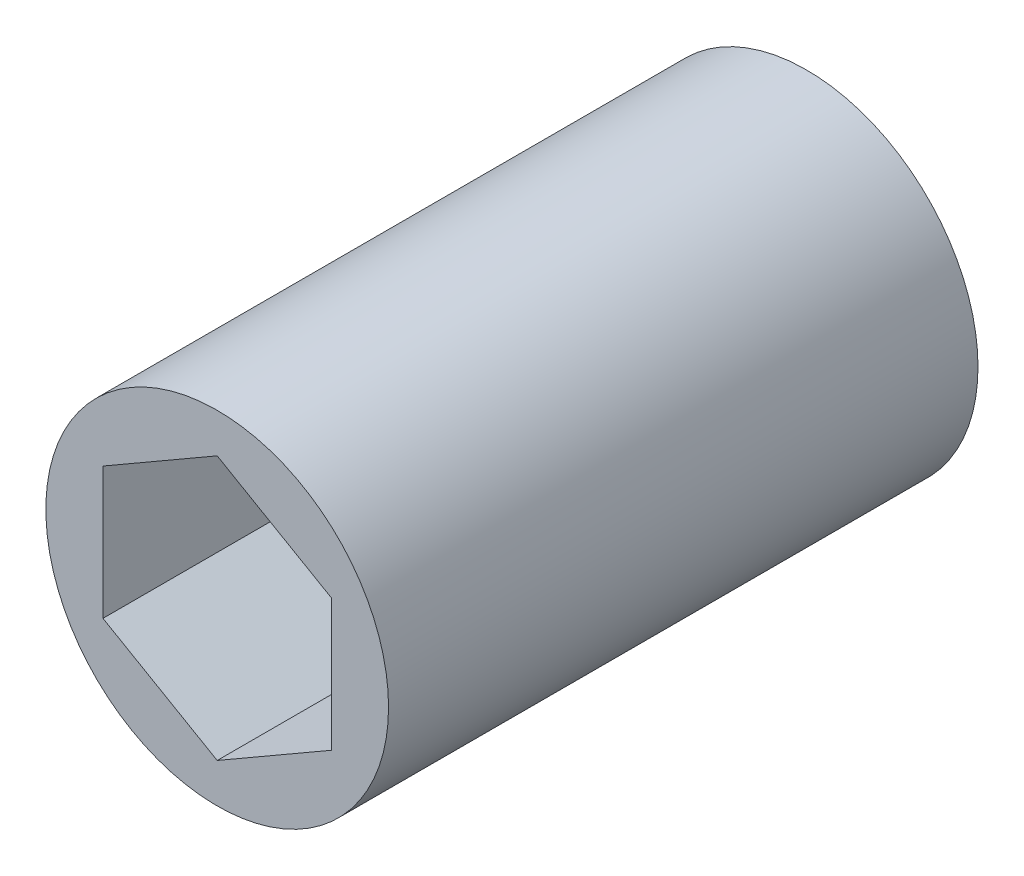
from build123d import *

# Parameters (mm, degrees)
SKETCH1_R           = 9.525
BOSS_EXTRUDE1_DEPTH = 32.766


with BuildPart() as part:
    # Sketch1 → Boss-Extrude1 (new body)
    with BuildSketch(Plane.XY):
        Circle(SKETCH1_R)
        Polygon((6.35, -3.666174209), (6.35, 3.666174209), (0, 7.332348419), (-6.35, 3.666174209), (-6.35, -3.666174209), (0, -7.332348419), align=None, mode=Mode.SUBTRACT)
    extrude(amount=BOSS_EXTRUDE1_DEPTH)


solid = part.part
